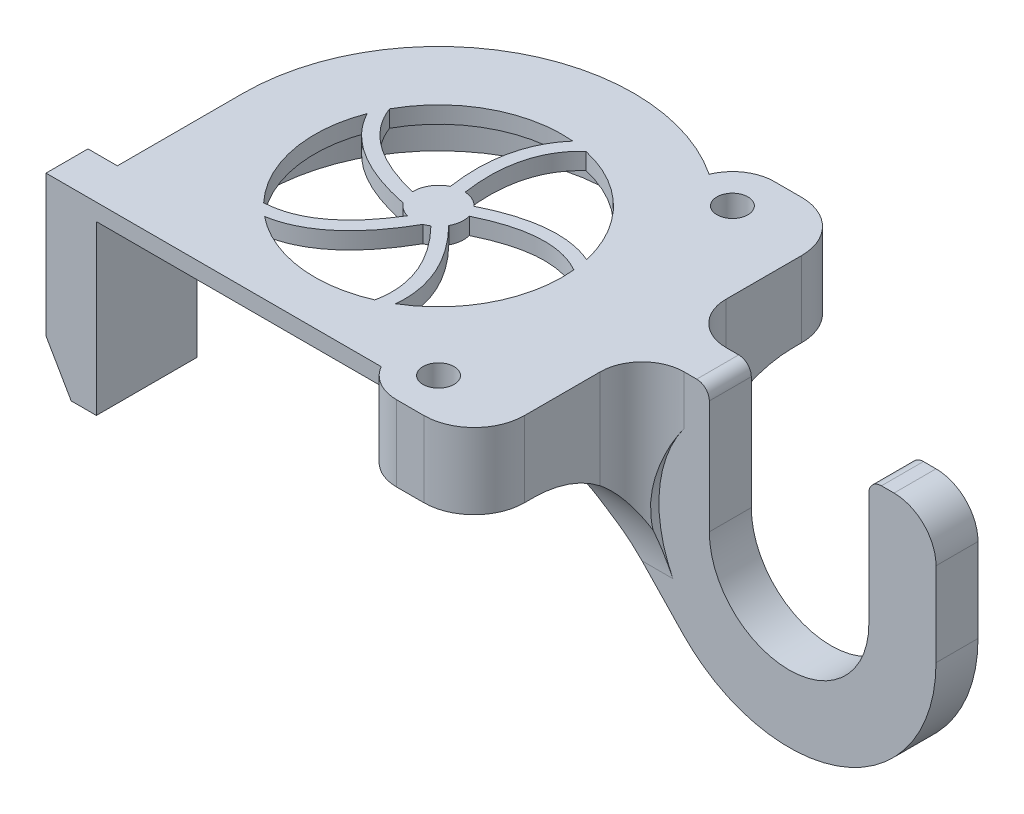
from build123d import *

# Parameters (mm, degrees)
SKETCH1_R           = 1.85
BOSS_EXTRUDE1_DEPTH = 9
BOSS_EXTRUDE4_DEPTH = 2.5
FILLET5_R           = 5
SKETCH9_R           = 14.735024394
BOSS_EXTRUDE5_DEPTH = 2
BOSS_EXTRUDE6_DEPTH = 2
FILLET6_R           = 1.5
FILLET9_R           = 13
FILLET10_R          = 5
SKETCH7_R           = 15.5
CUT_EXTRUDE4_DEPTH  = 5
CUT_EXTRUDE5_START  = 5
SKETCH8_R           = 15.5
CUT_EXTRUDE5_DEPTH  = 5
FILLET11_R          = 10
FILLET12_R          = 6
BOSS_EXTRUDE7_DEPTH = 22
CHAMFER1_SIZE       = 3
CHAMFER1_SIZE2      = 5.196152423


with BuildPart() as part:
    # Sketch1 → Boss-Extrude1 (new body)
    with BuildSketch(Plane(origin=(0, 0, 0), x_dir=(1, 0, 0), z_dir=(0, 1, 0))):
        with BuildLine():
            Line((-20.75, 0), (-20.75, -20))
            Line((-20.75, -20), (-23.25, -20))
            Line((-23.25, -20), (-23.25, 0))
            ThreePointArc((-23.25, 0), (-20.489109552, 10.989034979), (-12.862138515, 19.368218628))
            ThreePointArc((-12.862138515, 19.368218628), (0, 23.25), (12.862138515, 19.368218628))
            ThreePointArc((12.862138515, 19.368218628), (14.70188395, 21.643735823), (17.5, 22.5))
            Line((17.5, 22.5), (18.75, 22.5))
            Line((18.75, 22.5), (26.75, 22.5))
            Line((26.75, 22.5), (26.75, -22.5))
            Line((26.75, -22.5), (17.5, -22.5))
            ThreePointArc((17.5, -22.5), (12.52620039, -18.011192175), (16.482973024, -12.604526976))
            ThreePointArc((16.482973024, -12.604526976), (6.653600895, 19.654314924), (-20.75, 0))
        make_face()
        with Locations(Location((17.5, 17.5, 0), (0, 0, 270))):
            Circle(SKETCH1_R, mode=Mode.SUBTRACT)
        with Locations(Location((17.5, -17.5, 0), (0, 0, 270))):
            Circle(SKETCH1_R, mode=Mode.SUBTRACT)
    extrude(amount=BOSS_EXTRUDE1_DEPTH)

    # Sketch6 → Boss-Extrude4 (add, symmetric)
    with BuildSketch(Plane.XY):
        with BuildLine():
            Line((21.25, 9), (34.75, 9))
            Line((34.75, 9), (34.75, -6))
            ThreePointArc((34.75, -6), (44.25, -15.5), (53.75, -6))
            Line((53.75, -6), (53.75, 9))
            Line((53.75, 9), (61.75, 9))
            Line((61.75, 9), (61.75, -6))
            ThreePointArc((61.75, -6), (50.758759211, -22.244569971), (31.591593881, -18.083656505))
            Line((31.591593881, -18.083656505), (21.25, -7.250172849))
            Line((21.25, -7.250172849), (21.25, 9))
        make_face()
    extrude(amount=BOSS_EXTRUDE4_DEPTH, both=True)

    # Fillet5
    fillet5_edges = [part.edges().sort_by_distance(p)[0] for p in [
        (61.75, 9, 0),
    ]]
    fillet(fillet5_edges, radius=FILLET5_R)

    # Sketch9 → Boss-Extrude5 (add)
    with BuildSketch(Plane(origin=(0, 9, 0), x_dir=(1, 0, 0), z_dir=(0, 1, 0))):
        with BuildLine():
            Line((-22, 0), (-22, -20))
            Line((-22, -20), (13.169872981, -20))
            Line((13.169872981, -20), (18.372358938, -12.101918321))
            ThreePointArc((18.372358938, -12.101918321), (6.316965386, 21.073584136), (-22, 0))
        make_face()
        with Locations(Location((0, 0, 0), (0, 0, 270))):
            Circle(SKETCH9_R, mode=Mode.SUBTRACT)
    extrude(amount=-BOSS_EXTRUDE5_DEPTH)

    # Sketch11 → Boss-Extrude6 (add)
    with BuildSketch(Plane(origin=(0, 9, 0), x_dir=(1, 0, 0), z_dir=(0, 1, 0))):
        with BuildLine():
            Line((5.220162089, 17.573337339), (5.87977871, 16.226152899))
            add(Edge.make_bspline(
                [(0.173335061, 2.994980027), (0.166282187, 3.043139443), (0.025416971, 4.03078064), (-0.122519627, 5.866703962), (0.016214602, 8.259109045), (0.497519555, 10.370204143), (1.31303264, 12.208435745), (2.460581195, 13.793389175), (3.709471542, 14.920316582), (4.882685684, 15.702927506), (5.546682991, 16.063060552), (5.87977871, 16.226152899)],
                knots=[0.11860802, 0.11860802, 0.11860802, 0.11860802, 0.125, 0.25, 0.375, 0.5, 0.625, 0.75, 0.875, 0.9375, 1, 1, 1, 1], degree=3))
            ThreePointArc((0.173335061, 2.994980027), (1.259160125, 2.722951741), (2.16967899, 2.071821297))
            add(Edge.make_bspline(
                [(2.16967899, 2.071821297), (2.282995311, 2.128203955), (3.255962576, 2.604016946), (5.089911777, 3.361812946), (7.586503201, 4.018718803), (10.014904113, 4.240941466), (12.324348897, 4.003701011), (14.49589918, 3.301820259), (16.175766344, 2.332464651), (17.429810721, 1.341213836), (18.03828568, 0.763185028), (18.326355788, 0.465790715)],
                knots=[0.115512242, 0.115512242, 0.115512242, 0.115512242, 0.131137242, 0.25, 0.375, 0.5, 0.625, 0.75, 0.875, 0.9375, 1, 1, 1, 1], degree=3))
            Line((18.326355788, 0.465790715), (17.248939994, -0.577844857))
            add(Edge.make_bspline(
                [(2.90195875, 0.760648287), (3.008976445, 0.813531555), (3.905637345, 1.248946239), (5.598907742, 1.944420715), (7.859890064, 2.536784051), (10.016392223, 2.7314001), (12.016661769, 2.523845872), (13.878654062, 1.922239886), (15.336354057, 1.082714303), (16.443204384, 0.208761424), (16.990897717, -0.31145031), (17.248939994, -0.577844857)],
                knots=[0.118628153, 0.118628153, 0.118628153, 0.118628153, 0.134253153, 0.25, 0.375, 0.5, 0.625, 0.75, 0.875, 0.9375, 1, 1, 1, 1], degree=3))
            ThreePointArc((2.90195875, 0.760648287), (2.978782874, -0.356094079), (2.640886825, -1.423259352))
            add(Edge.make_bspline(
                [(2.640886825, -1.423259352), (2.729526588, -1.513606378), (3.482715054, -2.291918935), (4.770143348, -3.801936431), (6.166387121, -5.973340899), (7.128150585, -8.214216832), (7.616179189, -10.483940674), (7.619696868, -12.766100802), (7.216892403, -14.663296771), (6.66167788, -16.162277196), (6.299968919, -16.919591995), (6.106148678, -17.285462845)],
                knots=[0.115512242, 0.115512242, 0.115512242, 0.115512242, 0.131137242, 0.25, 0.375, 0.5, 0.625, 0.75, 0.875, 0.9375, 1, 1, 1, 1], degree=3))
            Line((6.106148678, -17.285462845), (4.780652476, -16.583280661))
            add(Edge.make_bspline(
                [(1.620174081, -2.524873532), (1.703539344, -2.61031158), (2.394726773, -3.328536234), (3.579411634, -4.724018647), (4.841464606, -6.69129028), (5.692951283, -8.682106044), (6.113672765, -10.648613214), (6.116898734, -12.605379591), (5.768916529, -14.251162342), (5.279773509, -15.57390585), (4.954269297, -16.25554743), (4.780652476, -16.583280661)],
                knots=[0.118628153, 0.118628153, 0.118628153, 0.118628153, 0.134253153, 0.25, 0.375, 0.5, 0.625, 0.75, 0.875, 0.9375, 1, 1, 1, 1], degree=3))
            ThreePointArc((1.620174081, -2.524873532), (1.315252723, -2.696305005), (0.99244883, -2.831076778))
            add(Edge.make_bspline(
                [(0.99244883, -2.831076778), (0.937538904, -2.927959561), (0.7232378, -3.301646868), (0.374053947, -3.882151606), (-0.446562516, -5.160677737), (-1.70384335, -6.847495127), (-3.510339023, -8.691693442), (-5.481195247, -10.127743458), (-7.585536138, -11.108339019), (-9.80975771, -11.619323973), (-11.749023041, -11.648546507), (-13.333942247, -11.440612408), (-14.152734799, -11.256390166), (-14.552548365, -11.148794264)],
                knots=[0.049558007, 0.049558007, 0.049558007, 0.049558007, 0.0625, 0.099887242, 0.131137242, 0.25, 0.375, 0.5, 0.625, 0.75, 0.875, 0.9375, 1, 1, 1, 1], degree=3))
            Line((-14.552548365, -11.148794264), (-14.294334275, -9.671186237))
            add(Edge.make_bspline(
                [(-0.826505377, -2.883893075), (-0.902087226, -3.006880569), (-1.107132759, -3.334768374), (-1.799624754, -4.391532601), (-2.973947113, -5.938371002), (-4.622418942, -7.595318801), (-6.382503071, -8.856461468), (-8.211834949, -9.691746986), (-10.121774601, -10.117276757), (-11.803872413, -10.132750321), (-13.201016983, -9.940660935), (-13.936851049, -9.769966876), (-14.294334275, -9.671186237)],
                knots=[0.084683234, 0.084683234, 0.084683234, 0.084683234, 0.103003153, 0.134253153, 0.25, 0.375, 0.5, 0.625, 0.75, 0.875, 0.9375, 1, 1, 1, 1], degree=3))
            ThreePointArc((-0.826505377, -2.883893075), (-1.692164513, -2.477201983), (-2.385830464, -1.818725764))
            add(Edge.make_bspline(
                [(-2.385830464, -1.818725764), (-2.494939566, -1.796441747), (-2.916559997, -1.708105014), (-3.576556556, -1.555397264), (-5.046091597, -1.170030932), (-7.038871412, -0.495541042), (-9.3510461, 0.652649819), (-11.325838892, 2.083281613), (-12.908717787, 3.781608038), (-14.082015623, 5.739065422), (-14.709073848, 7.574386093), (-15.001083737, 9.145989002), (-15.078898787, 9.981634798), (-15.10011819, 10.395129057)],
                knots=[0.049558007, 0.049558007, 0.049558007, 0.049558007, 0.0625, 0.099887242, 0.131137242, 0.25, 0.375, 0.5, 0.625, 0.75, 0.875, 0.9375, 1, 1, 1, 1], degree=3))
            Line((-15.10011819, 10.395129057), (-13.615036905, 10.606158856))
            add(Edge.make_bspline(
                [(-2.998149509, -0.105118645), (-3.138473643, -0.071241261), (-3.513676031, 0.022445725), (-4.732710329, 0.354486644), (-6.566726635, 0.993334222), (-8.651983447, 2.049099069), (-10.395297306, 3.333324033), (-11.754995679, 4.815004615), (-12.749902352, 6.499969236), (-13.284415395, 8.094957727), (-13.533468949, 9.483080059), (-13.598514483, 10.235647208), (-13.615036905, 10.606158856)],
                knots=[0.084683234, 0.084683234, 0.084683234, 0.084683234, 0.103003153, 0.134253153, 0.25, 0.375, 0.5, 0.625, 0.75, 0.875, 0.9375, 1, 1, 1, 1], degree=3))
            ThreePointArc((-2.998149509, -0.105118645), (-2.567256331, 1.552142176), (-1.299951464, 2.703715332))
            add(Edge.make_bspline(
                [(-1.299951464, 2.703715332), (-1.311287633, 2.77972172), (-1.46566004, 3.851114912), (-1.626846281, 5.836767679), (-1.477670288, 8.457045711), (-0.938599449, 10.835262802), (0.000687318, 12.95836398), (1.339261522, 14.806737947), (2.780280992, 16.104839203), (4.110537563, 16.991192932), (4.84830473, 17.391266282), (5.220162089, 17.573337339)],
                knots=[0.115485916, 0.115485916, 0.115485916, 0.115485916, 0.125, 0.25, 0.375, 0.5, 0.625, 0.75, 0.875, 0.9375, 1, 1, 1, 1], degree=3))
        make_face()
    extrude(amount=-BOSS_EXTRUDE6_DEPTH)

    # Fillet6
    fillet6_edges = [part.edges().sort_by_distance(p)[0] for p in [
        (34.75, 9, 0),
        (53.75, 9, 0),
    ]]
    fillet(fillet6_edges, radius=FILLET6_R)

    # Fillet9
    # the kernel refuses this fillet: 13 mm, written as the material it adds along each edge
    with BuildSketch(Plane(origin=(21.25, 0, 2.5), x_dir=(0, -1, 0), z_dir=(1, 0, 0))) as fillet9_piece_1_section:
        with BuildLine():
            CenterArc((FILLET9_R, -FILLET9_R), FILLET9_R, 90, 90)
            Line((0, -FILLET9_R), (0, 0))
            Line((0, 0), (FILLET9_R, 0))
        make_face()
    fillet9_piece_1 = extrude(amount=5.5, mode=Mode.PRIVATE)
    fillet9_piece_1 = split(fillet9_piece_1, bisect_by=Plane(origin=(20.346495431, -6.303693795, 5.449410557), z_dir=(0.7233374924872102, 0.6904946574466128, 0)), keep=Keep.TOP, mode=Mode.PRIVATE)
    add(fillet9_piece_1)
    with BuildSketch(Plane(origin=(21.25, 0, -2.5), x_dir=(0, 0, -1), z_dir=(1, 0, 0))) as fillet9_piece_2_section:
        with BuildLine():
            CenterArc((FILLET9_R, -FILLET9_R), FILLET9_R, 90, 90)
            Line((0, -FILLET9_R), (0, 0))
            Line((0, 0), (FILLET9_R, 0))
        make_face()
    fillet9_piece_2 = extrude(amount=5.5, mode=Mode.PRIVATE)
    fillet9_piece_2 = split(fillet9_piece_2, bisect_by=Plane(origin=(20.346398639, -6.3035924, -5.449752189), z_dir=(0.7233374924872102, 0.6904946574466128, 0)), keep=Keep.TOP, mode=Mode.PRIVATE)
    add(fillet9_piece_2)

    # Fillet10
    fillet10_edges = [part.edges().sort_by_distance(p)[0] for p in [
        (26.75, -2, -2.5),
        (26.75, -2, 2.5),
    ]]
    fillet(fillet10_edges, radius=FILLET10_R)

    # Sketch7 → Cut-Extrude4 (cut)
    with BuildSketch(Plane(origin=(0, 0, -2.5), x_dir=(-1, 0, 0), z_dir=(0, 0, -1))):
        with Locations((-44.25, -6)):
            Circle(SKETCH7_R)
    extrude(amount=CUT_EXTRUDE4_DEPTH, mode=Mode.SUBTRACT)

    # Sketch8 → Cut-Extrude5 (cut)
    with BuildSketch(Plane.XY.offset(2.5).offset(CUT_EXTRUDE5_START)):
        with Locations((44.25, -6)):
            Circle(SKETCH8_R)
    extrude(amount=-CUT_EXTRUDE5_DEPTH, mode=Mode.SUBTRACT)

    # Fillet11
    fillet11_edges = [part.edges().sort_by_distance(p)[0] for p in [
        (21.25, -7.250172849, 0),
    ]]
    fillet(fillet11_edges, radius=FILLET11_R)

    # Fillet12
    fillet12_edges = [part.edges().sort_by_distance(p)[0] for p in [
        (26.75, 4.5, -22.5),
        (26.75, 4.5, 22.5),
    ]]
    fillet(fillet12_edges, radius=FILLET12_R)

    # Sketch16 → Boss-Extrude7 (add)
    with BuildSketch(Plane(origin=(0, 9, 0), x_dir=(1, 0, 0), z_dir=(0, 1, 0))):
        Polygon((-23.25, -8), (-23.25, -15), (-26.75, -15), (-26.75, -20), (-20.75, -20), (-20.75, -8), align=None)
    extrude(amount=-BOSS_EXTRUDE7_DEPTH)

    # Chamfer1
    chamfer1_edges = [part.edges().sort_by_distance(p)[0] for p in [
        (-26.75, -13, 17.5),
    ]]
    chamfer1_side = [part.faces().sort_by_distance(p)[0] for p in [
        (-23.105263158, -13, 15.289473684),
    ]]
    chamfer(chamfer1_edges, length=CHAMFER1_SIZE, length2=CHAMFER1_SIZE2, reference=chamfer1_side[0])


solid = part.part
